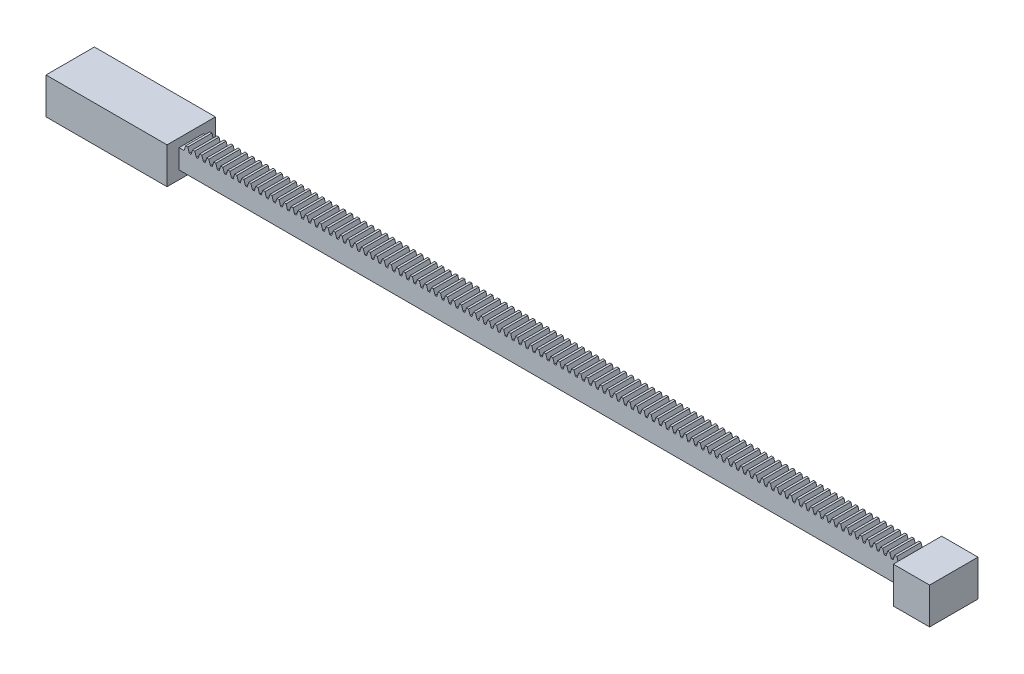
from build123d import *

# Parameters (mm, degrees)
BOSS_EXTRUDE1_DEPTH = 10
BOSS_EXTRUDE2_DEPTH = 10
LPATTERN1_COUNT     = 103
LPATTERN1_PITCH     = 2.9
SKETCH3_W           = 20
SKETCH3_H           = 15
BOSS_EXTRUDE3_DEPTH = 15
SKETCH4_W           = 20
SKETCH4_H           = 15
BOSS_EXTRUDE4_DEPTH = 50


with BuildPart() as part:
    # Sketch1 → Boss-Extrude1 (new body)
    with BuildSketch(Plane.XY):
        Polygon((150, 4), (147.839375153, 4), (147.1, 4), (144.939375153, 4), (144.2, 4), (142.039375153, 4), (141.3, 4), (139.139375153, 4), (138.4, 4), (136.239375153, 4), (135.5, 4), (133.339375153, 4), (132.6, 4), (130.439375153, 4), (129.7, 4), (127.539375153, 4), (126.8, 4), (124.639375153, 4), (123.9, 4), (121.739375153, 4), (121, 4), (118.839375153, 4), (118.1, 4), (115.939375153, 4), (115.2, 4), (113.039375153, 4), (112.3, 4), (110.139375153, 4), (109.4, 4), (107.239375153, 4), (106.5, 4), (104.339375153, 4), (103.6, 4), (101.439375153, 4), (100.7, 4), (98.539375153, 4), (97.8, 4), (95.639375153, 4), (94.9, 4), (92.739375153, 4), (92, 4), (89.839375153, 4), (89.1, 4), (86.939375153, 4), (86.2, 4), (84.039375153, 4), (83.3, 4), (81.139375153, 4), (80.4, 4), (78.239375153, 4), (77.5, 4), (75.339375153, 4), (74.6, 4), (72.439375153, 4), (71.7, 4), (69.539375153, 4), (68.8, 4), (66.639375153, 4), (65.9, 4), (63.739375153, 4), (63, 4), (60.839375153, 4), (60.1, 4), (57.939375153, 4), (57.2, 4), (55.039375153, 4), (54.3, 4), (52.139375153, 4), (51.4, 4), (49.239375153, 4), (48.5, 4), (46.339375153, 4), (45.6, 4), (43.439375153, 4), (42.7, 4), (40.539375153, 4), (39.8, 4), (37.639375153, 4), (36.9, 4), (34.739375153, 4), (34, 4), (31.839375153, 4), (31.1, 4), (28.939375153, 4), (28.2, 4), (26.039375153, 4), (25.3, 4), (23.139375153, 4), (22.4, 4), (20.239375153, 4), (19.5, 4), (17.339375153, 4), (16.6, 4), (14.439375153, 4), (13.7, 4), (11.539375153, 4), (10.8, 4), (8.639375153, 4), (7.9, 4), (5.739375153, 4), (5, 4), (2.839375153, 4), (2.1, 4), (-0.060624847, 4), (-0.8, 4), (-2.960624847, 4), (-3.7, 4), (-5.860624847, 4), (-6.6, 4), (-8.760624847, 4), (-9.5, 4), (-11.660624847, 4), (-12.4, 4), (-14.560624847, 4), (-15.3, 4), (-17.460624847, 4), (-18.2, 4), (-20.360624847, 4), (-21.1, 4), (-23.260624847, 4), (-24, 4), (-26.160624847, 4), (-26.9, 4), (-29.060624847, 4), (-29.8, 4), (-31.960624847, 4), (-32.7, 4), (-34.860624847, 4), (-35.6, 4), (-37.760624847, 4), (-38.5, 4), (-40.660624847, 4), (-41.4, 4), (-43.560624847, 4), (-44.3, 4), (-46.460624847, 4), (-47.2, 4), (-49.360624847, 4), (-50.1, 4), (-52.260624847, 4), (-53, 4), (-55.160624847, 4), (-55.9, 4), (-58.060624847, 4), (-58.8, 4), (-60.960624847, 4), (-61.7, 4), (-63.860624847, 4), (-64.6, 4), (-66.760624847, 4), (-67.5, 4), (-69.660624847, 4), (-70.4, 4), (-72.560624847, 4), (-73.3, 4), (-75.460624847, 4), (-76.2, 4), (-78.360624847, 4), (-79.1, 4), (-81.260624847, 4), (-82, 4), (-84.160624847, 4), (-84.9, 4), (-87.060624847, 4), (-87.8, 4), (-89.960624847, 4), (-90.7, 4), (-92.860624847, 4), (-93.6, 4), (-95.760624847, 4), (-96.5, 4), (-98.660624847, 4), (-99.4, 4), (-101.560624847, 4), (-102.3, 4), (-104.460624847, 4), (-105.2, 4), (-107.360624847, 4), (-108.1, 4), (-110.260624847, 4), (-111, 4), (-113.160624847, 4), (-113.9, 4), (-116.060624847, 4), (-116.8, 4), (-118.960624847, 4), (-119.7, 4), (-121.860624847, 4), (-122.6, 4), (-124.760624847, 4), (-125.5, 4), (-127.660624847, 4), (-128.4, 4), (-130.560624847, 4), (-131.3, 4), (-133.460624847, 4), (-134.2, 4), (-136.360624847, 4), (-137.1, 4), (-139.260624847, 4), (-140, 4), (-142.160624847, 4), (-142.9, 4), (-145.060624847, 4), (-145.8, 4), (-147.960624847, 4), (-150, 4), (-150, -4), (150, -4), align=None)
    extrude(amount=BOSS_EXTRUDE1_DEPTH)

    # Sketch2 → Boss-Extrude2 (add)
    with BuildSketch(Plane.XY.offset(10)):
        Polygon((147.839375153, 4), (148.479687576, 6), (149.359687576, 6), (150, 4), align=None)
    boss_extrude2 = extrude(amount=-BOSS_EXTRUDE2_DEPTH)

    # LPattern1: Boss-Extrude2 ×103
    with Locations(*[(-i * LPATTERN1_PITCH, 0, 0) for i in range(1, LPATTERN1_COUNT)]):
        add(boss_extrude2)

    # Sketch3 → Boss-Extrude3 (add)
    with BuildSketch(Plane(origin=(150, 0, 0), x_dir=(0, 0, -1), z_dir=(1, 0, 0))):
        with Locations((-5, 0)):
            Rectangle(SKETCH3_W, SKETCH3_H)
    extrude(amount=BOSS_EXTRUDE3_DEPTH)

    # Sketch4 → Boss-Extrude4 (add)
    with BuildSketch(Plane.ZY.offset(150)):
        with Locations((5, 0)):
            Rectangle(SKETCH4_W, SKETCH4_H)
    extrude(amount=BOSS_EXTRUDE4_DEPTH)


solid = part.part
